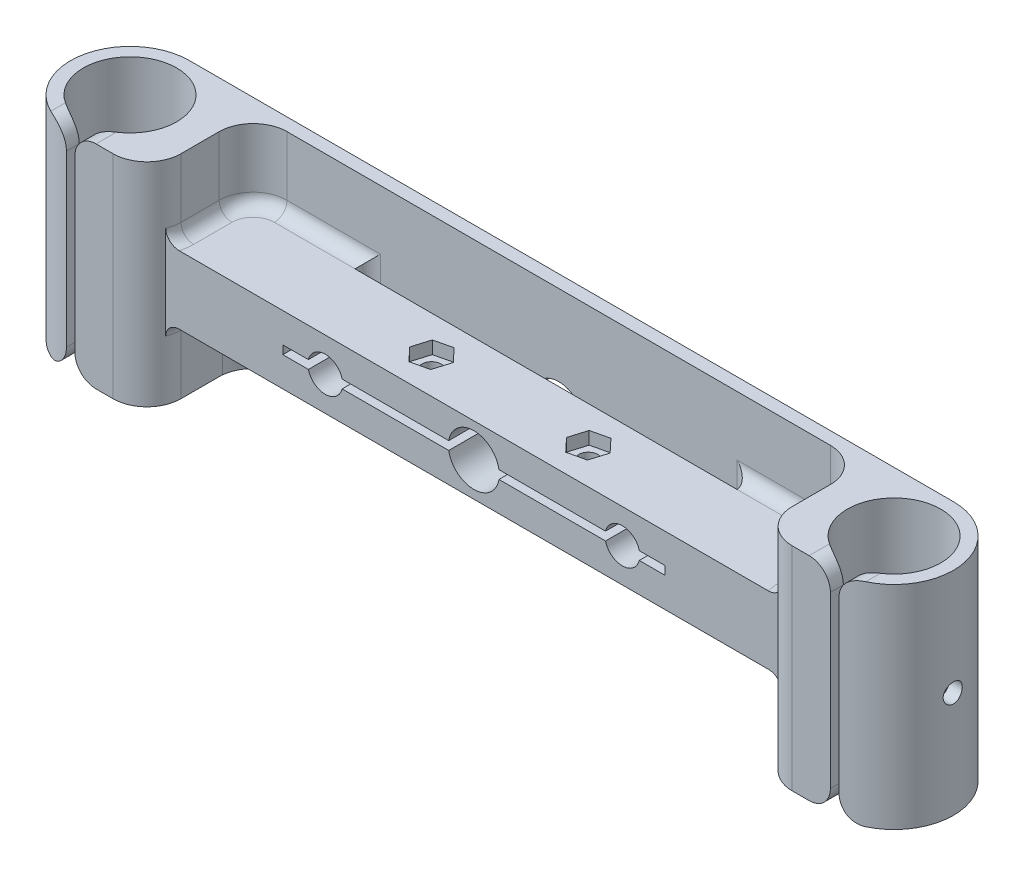
from build123d import *

# Parameters (mm, degrees)
SKETCH1_R                    = 11
BOSS_EXTRUDE1_DEPTH          = 100
FILLET1_R                    = 8
SKETCH2_R                    = 4.1
SKETCH2_R_2                  = 6
CUT_EXTRUDE1_DEPTH           = 10
BOSS_EXTRUDE2_START          = 20
SKETCH3_R                    = 4.1
SKETCH3_R_2                  = 6
BOSS_EXTRUDE2_DEPTH          = 20
FILLET2_R                    = 3
CUT_EXTRUDE_THIN1_DEPTH      = 183.94618817
CUT_EXTRUDE_THIN1_DEPTH_BACK = 20
CUT_EXTRUDE_THIN2_DEPTH      = 163.832913644
CUT_EXTRUDE_THIN2_DEPTH_BACK = 20
FILLET3_R                    = 3
CUT_EXTRUDE2_DEPTH           = 161.472919104
CUT_EXTRUDE2_DEPTH_BACK      = 161.472919104
SKETCH6_R                    = 2.25
CUT_EXTRUDE3_DEPTH           = 3
CUT_EXTRUDE4_DEPTH           = 25
CUT_EXTRUDE5_START           = 25
CUT_EXTRUDE5_DEPTH           = 25
CUT_EXTRUDE6_START           = -53
CUT_EXTRUDE6_DEPTH           = 92
CUT_EXTRUDE7_DEPTH           = 4
CUT_EXTRUDE_THIN3_START      = -10
SKETCH12_W                   = 2
SKETCH12_H                   = 50
CUT_EXTRUDE_THIN3_DEPTH      = 182.316396812
FILLET4_R                    = 5
FILLET5_R                    = 5
FILLET6_R                    = 5


with BuildPart() as part:
    # Sketch1 → Boss-Extrude1 (new body)
    with BuildSketch(Plane(origin=(0, 0, 0), x_dir=(1, 0, 0), z_dir=(0, 1, 0))):
        with BuildLine():
            Line((137.460581558, -14.5), (119.460581558, -14.5))
            Line((119.460581558, -14.5), (119.460581558, 10.5))
            Line((119.460581558, 10.5), (-24.539418442, 10.5))
            Line((-24.539418442, 10.5), (-24.539418442, -14.5))
            Line((-24.539418442, -14.5), (-42.539418442, -14.5))
            ThreePointArc((-42.539418442, -14.5), (-56.539418442, -0.5), (-42.539418442, 13.5))
            Line((-42.539418442, 13.5), (137.460581558, 13.5))
            ThreePointArc((137.460581558, 13.5), (151.460581558, -0.5), (137.460581558, -14.5))
        make_face()
        with Locations(Location((-42.539418442, -0.5, 0), (0, 0, 270))):
            Circle(SKETCH1_R, mode=Mode.SUBTRACT)
        with Locations(Location((137.460581558, -0.5, 0), (0, 0, 270))):
            Circle(SKETCH1_R, mode=Mode.SUBTRACT)
    extrude(amount=BOSS_EXTRUDE1_DEPTH)

    # Fillet1
    fillet1_edges = [part.edges().sort_by_distance(p)[0] for p in [
        (119.460581558, 50, 14.5),
        (119.460581558, 50, -10.5),
        (-24.539418442, 50, -10.5),
        (-24.539418442, 50, 14.5),
    ]]
    fillet(fillet1_edges, radius=FILLET1_R)

    # Sketch2 → Cut-Extrude1 (cut)
    with BuildSketch(Plane.XY.offset(-10.5)):
        with Locations((12.460581558, 50)):
            Circle(SKETCH2_R)
        with Locations((82.460581558, 50)):
            Circle(SKETCH2_R)
        with Locations((47.460581558, 50)):
            Circle(SKETCH2_R_2)
    extrude(amount=-CUT_EXTRUDE1_DEPTH, mode=Mode.SUBTRACT)

    # Sketch3 → Boss-Extrude2 (add)
    with BuildSketch(Plane.XY.offset(-10.5).offset(BOSS_EXTRUDE2_START)):
        Polygon((12.460581558, 58), (82.460581558, 58), (124.149440998, 58), (124.149440998, 42), (82.460581558, 42), (12.460581558, 42), (-28.8662965, 42), (-28.8662965, 58), (-16.539418442, 58), align=None)
        with Locations((12.460581558, 50)):
            Circle(SKETCH3_R, mode=Mode.SUBTRACT)
        with Locations((82.460581558, 50)):
            Circle(SKETCH3_R, mode=Mode.SUBTRACT)
        with Locations((47.460581558, 50)):
            Circle(SKETCH3_R_2, mode=Mode.SUBTRACT)
    extrude(amount=-BOSS_EXTRUDE2_DEPTH)

    # Fillet2
    fillet2_edges = [part.edges().sort_by_distance(p)[0] for p in [
        (-24.686725022, 58, 8.0281381),
        (-24.686725022, 42, 8.0281381),
        (47.460581558, 42, -10.5),
        (117.117435807, 42, -8.156854249),
        (119.460581558, 42, 2),
        (-24.539418442, 42, 2),
        (-22.196272692, 42, -8.156854249),
        (119.607888138, 42, 8.0281381),
        (119.460581558, 58, 2),
        (117.117435807, 58, -8.156854249),
        (47.460581558, 58, -10.5),
        (-22.196272692, 58, -8.156854249),
        (-24.539418442, 58, 2),
        (119.607888138, 58, 8.0281381),
    ]]
    fillet(fillet2_edges, radius=FILLET2_R)

    # Sketch4 → Cut-Extrude-Thin1 (cut, two sides: drawn at the far end of the back side and taken through both)
    with BuildSketch(Plane.XY.offset(9.5).offset(-CUT_EXTRUDE_THIN1_DEPTH_BACK)):
        Polygon((92.460581558, 51), (47.460581558, 51), (2.460581558, 51), (2.460581558, 49), (47.460581558, 49), (92.460581558, 49), align=None)
    extrude(amount=CUT_EXTRUDE_THIN1_DEPTH + CUT_EXTRUDE_THIN1_DEPTH_BACK, mode=Mode.SUBTRACT)

    # Sketch5 → Cut-Extrude-Thin2 (cut, two sides: drawn at the far end of the back side and taken through both)
    with BuildSketch(Plane(origin=(0, 42, 0), x_dir=(-1, 0, 0), z_dir=(0, -1, 0)).offset(-CUT_EXTRUDE_THIN2_DEPTH_BACK)):
        Polygon((-2.460581558, 7.5), (-47.460581558, 7.5), (-92.460581558, 7.5), (-92.460581558, 10.5), (-47.460581558, 10.5), (-2.460581558, 10.5), align=None)
    extrude(amount=CUT_EXTRUDE_THIN2_DEPTH + CUT_EXTRUDE_THIN2_DEPTH_BACK, mode=Mode.SUBTRACT)

    # Fillet3
    fillet3_edges = [part.edges().sort_by_distance(p)[0] for p in [
        (92.460581558, 50, -10.5),
        (2.460581558, 50, -10.5),
    ]]
    fillet(fillet3_edges, radius=FILLET3_R - 0.0001)  # a hair under: the kernel refuses the full size

    # Sketch6 → Cut-Extrude2 (cut, two sides: drawn at the far end of the back side and taken through both)
    with BuildSketch(Plane(origin=(0, 49, 0), x_dir=(1, 0, 0), z_dir=(0, 1, 0)).offset(-CUT_EXTRUDE2_DEPTH_BACK)):
        with Locations(Location((28.990631201, -1, 0), (0, 0, 270))):
            Circle(SKETCH6_R)
        with Locations(Location((65.930531914, -1, 0), (0, 0, 270))):
            Circle(SKETCH6_R)
    extrude(amount=CUT_EXTRUDE2_DEPTH + CUT_EXTRUDE2_DEPTH_BACK, mode=Mode.SUBTRACT)

    # Sketch7 → Cut-Extrude3 (cut)
    with BuildSketch(Plane(origin=(0, 58, 0), x_dir=(1, 0, 0), z_dir=(0, 1, 0))):
        Polygon((33.150591825, -0.026315789), (30.227376252, 3.089473684), (26.067415628, 2.115789474), (24.830670578, -1.973684211), (27.753886151, -5.089473684), (31.913846775, -4.115789474), align=None)
        Polygon((70.090492538, -0.026315789), (67.167276964, 3.089473684), (63.007316341, 2.115789474), (61.77057129, -1.973684211), (64.693786864, -5.089473684), (68.853747488, -4.115789474), align=None)
    extrude(amount=-CUT_EXTRUDE3_DEPTH, mode=Mode.SUBTRACT)

    # Sketch8 → Cut-Extrude4 (cut)
    with BuildSketch(Plane(origin=(0, 100, 0), x_dir=(1, 0, 0), z_dir=(0, 1, 0))):
        with BuildLine():
            Line((119.460581558, 2.5), (119.460581558, -6.5))
            ThreePointArc((119.460581558, -6.5), (121.803727308, -12.156854249), (127.460581558, -14.5))
            Line((127.460581558, -14.5), (137.460581558, -14.5))
            ThreePointArc((137.460581558, -14.5), (151.460581558, -0.5), (137.460581558, 13.5))
            Line((137.460581558, 13.5), (-42.539418442, 13.5))
            ThreePointArc((-42.539418442, 13.5), (-56.539418442, -0.5), (-42.539418442, -14.5))
            Line((-42.539418442, -14.5), (-32.539418442, -14.5))
            ThreePointArc((-32.539418442, -14.5), (-26.882564193, -12.156854249), (-24.539418442, -6.5))
            Line((-24.539418442, -6.5), (-24.539418442, 2.5))
            ThreePointArc((-24.539418442, 2.5), (-22.196272692, 8.156854249), (-16.539418442, 10.5))
            Line((-16.539418442, 10.5), (111.460581558, 10.5))
            ThreePointArc((111.460581558, 10.5), (117.117435807, 8.156854249), (119.460581558, 2.5))
        make_face()
    extrude(amount=-CUT_EXTRUDE4_DEPTH, mode=Mode.SUBTRACT)

    # Sketch9 → Cut-Extrude5 (cut)
    with BuildSketch(Plane(origin=(0, 0, 0), x_dir=(1, 0, 0), z_dir=(0, 1, 0)).offset(CUT_EXTRUDE5_START)):
        with BuildLine():
            Line((127.460581558, -14.5), (137.460581558, -14.5))
            ThreePointArc((137.460581558, -14.5), (151.460581558, -0.5), (137.460581558, 13.5))
            Line((137.460581558, 13.5), (-42.539418442, 13.5))
            ThreePointArc((-42.539418442, 13.5), (-56.539418442, -0.5), (-42.539418442, -14.5))
            Line((-42.539418442, -14.5), (-32.539418442, -14.5))
            ThreePointArc((-32.539418442, -14.5), (-26.882564193, -12.156854249), (-24.539418442, -6.5))
            Line((-24.539418442, -6.5), (-24.539418442, 2.5))
            ThreePointArc((-24.539418442, 2.5), (-22.196272692, 8.156854249), (-16.539418442, 10.5))
            Line((-16.539418442, 10.5), (111.460581558, 10.5))
            ThreePointArc((111.460581558, 10.5), (117.117435807, 8.156854249), (119.460581558, 2.5))
            Line((119.460581558, 2.5), (119.460581558, -6.5))
            ThreePointArc((119.460581558, -6.5), (121.803727308, -12.156854249), (127.460581558, -14.5))
        make_face()
    extrude(amount=-CUT_EXTRUDE5_DEPTH, mode=Mode.SUBTRACT)

    # Sketch10 → Cut-Extrude6 (cut)
    with BuildSketch(Plane(origin=(-42.539418442, 0, 0), x_dir=(0, 0, -1), z_dir=(1, 0, 0)).offset(CUT_EXTRUDE6_START)):
        with BuildLine():
            ThreePointArc((-1.406161882, 52.059458823), (-2.559458823, 49.093838118), (0.406161882, 47.940541177))
            Line((0.406161882, 47.940541177), (-1.406161882, 52.059458823))
        make_face()
        with BuildLine():
            Line((-1.406161882, 52.059458823), (0.406161882, 47.940541177))
            ThreePointArc((0.406161882, 47.940541177), (1.384325375, 48.770439964), (1.75, 50))
            ThreePointArc((1.75, 50), (0.729560036, 51.884325375), (-1.406161882, 52.059458823))
        make_face()
    cut_extrude6 = extrude(amount=CUT_EXTRUDE6_DEPTH, mode=Mode.SUBTRACT)

    # Sketch11 → Cut-Extrude7 (cut)
    with BuildSketch(Plane(origin=(-24.539418442, 0, 0), x_dir=(0, 0, -1), z_dir=(1, 0, 0))):
        Polygon((3.25, 47.834936491), (3.25, 16.98540005), (-4.25, 16.98540005), (-4.25, 47.834936491), (-4.25, 52.165063509), (-0.5, 54.330127019), (3.25, 52.165063509), align=None)
    cut_extrude7 = extrude(amount=CUT_EXTRUDE7_DEPTH, mode=Mode.SUBTRACT)

    # Mirror1: Cut-Extrude6, Cut-Extrude7 across plane
    add(cut_extrude6.mirror(Plane(origin=(47.460581558, 0, 0), x_dir=(0, 0, 1), z_dir=(1, 0, 0))), mode=Mode.SUBTRACT)
    add(cut_extrude7.mirror(Plane(origin=(47.460581558, 0, 0), x_dir=(0, 0, 1), z_dir=(1, 0, 0))), mode=Mode.SUBTRACT)

    # Sketch12 → Cut-Extrude-Thin3 (cut)
    with BuildSketch(Plane.XY.offset(14.5).offset(CUT_EXTRUDE_THIN3_START)):
        with Locations((137.460581558, 50)):
            Rectangle(SKETCH12_W, SKETCH12_H)
    cut_extrude_thin3 = extrude(amount=CUT_EXTRUDE_THIN3_DEPTH, mode=Mode.SUBTRACT)

    # Mirror2: Cut-Extrude-Thin3 across plane
    add(cut_extrude_thin3.mirror(Plane(origin=(47.460581558, 0, 0), x_dir=(0, 0, 1), z_dir=(1, 0, 0))), mode=Mode.SUBTRACT)

    # Fillet4
    fillet4_edges = [part.edges().sort_by_distance(p)[0] for p in [
        (-43.539418442, 75, 12.959345597),
        (-43.539418442, 25, 12.959345597),
        (-41.539418442, 25, 12.977225575),
        (-41.539418442, 75, 12.977225575),
    ]]
    fillet(fillet4_edges, radius=FILLET4_R)

    # Fillet5
    fillet5_edges = [part.edges().sort_by_distance(p)[0] for p in [
        (136.460581558, 25, 12.977225575),
        (138.460581558, 25, 12.959345597),
    ]]
    fillet(fillet5_edges, radius=FILLET5_R)

    # Fillet6
    fillet6_edges = [part.edges().sort_by_distance(p)[0] for p in [
        (136.460581558, 75, 12.977225575),
        (138.460581558, 75, 12.959345597),
    ]]
    fillet(fillet6_edges, radius=FILLET6_R)


solid = part.part
